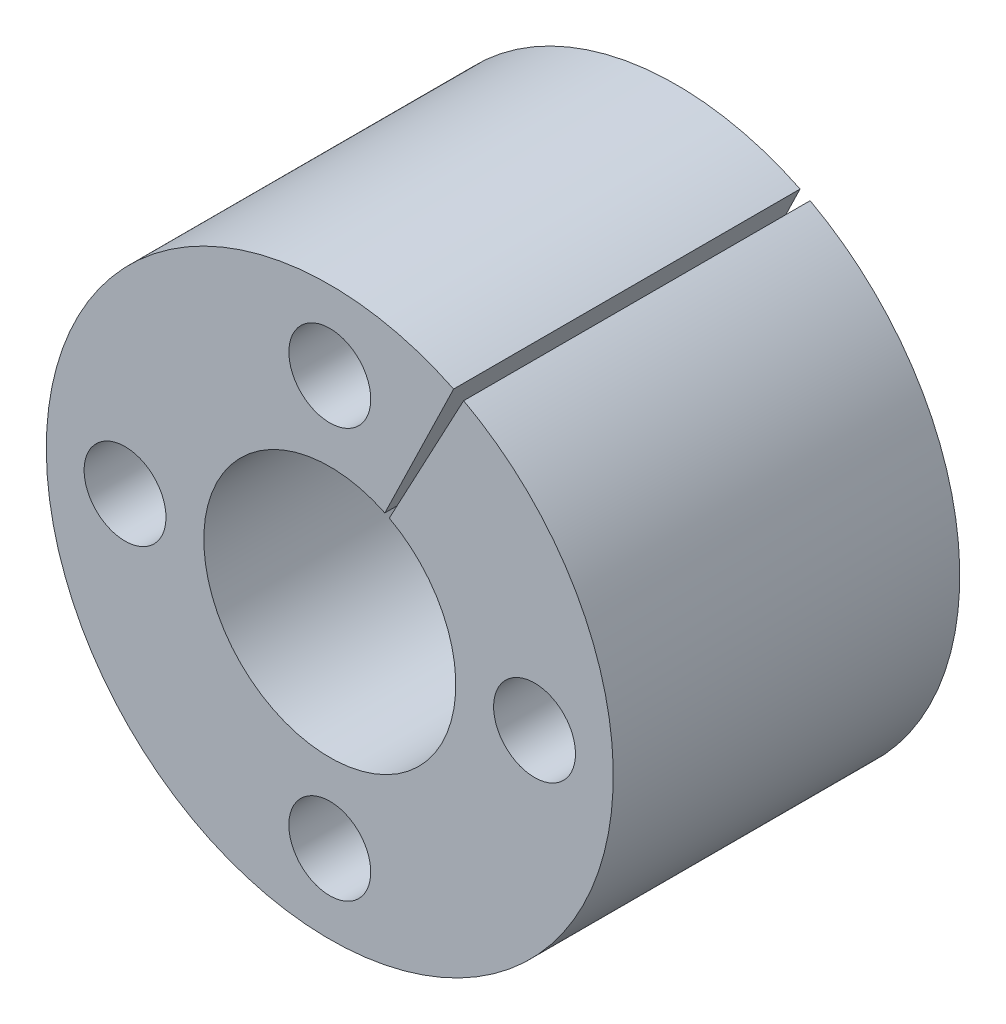
from build123d import *

# Parameters (mm, degrees)
SKETCH_1_R               = 9
SKETCH_1_R_2             = 4
EXTRUDE_1_DEPTH          = 11
CUT_EXTRUDE_1_OUTLINE_R  = 1.3
CUT_EXTRUDE_1_DEPTH      = 11
PATTERN_CIRCULAR_1_COUNT = 4
CUT_EXTRUDE_2_DEPTH      = 17.822603841


# Read off the part's stored shape, not the designer's step: 切除-拉伸1
with BuildPart() as part:
    # 草图1 → 凸台-拉伸1 (new body)
    with BuildSketch(Plane.XY):
        Circle(SKETCH_1_R)
        Circle(SKETCH_1_R_2, mode=Mode.SUBTRACT)
    extrude(amount=EXTRUDE_1_DEPTH)

    # 切除-拉伸1 outline → 切除-拉伸1 (cut)
    with BuildSketch(Plane.XY):
        with Locations((0, 6.5)):
            Circle(CUT_EXTRUDE_1_OUTLINE_R)
    cut_extrude_1 = extrude(amount=CUT_EXTRUDE_1_DEPTH, mode=Mode.SUBTRACT)

    # 阵列(圆周)1: 切除-拉伸1 ×4 about axis
    pattern_circular_1_axis = Axis((0, 0, 0), (0, 0, 1))
    for i in range(1, PATTERN_CIRCULAR_1_COUNT):
        add(cut_extrude_1.rotate(pattern_circular_1_axis, i * 360 / PATTERN_CIRCULAR_1_COUNT), mode=Mode.SUBTRACT)

    # 草图6 → 切除-拉伸2 (cut, through all)
    with BuildSketch(Plane(origin=(0, 0, 0), x_dir=(-1, 0, 0), z_dir=(0, 0, -1))):
        with BuildLine():
            Line((-4.248676402, 7.934024756), (0, 0))
            Line((0, 0), (-3.930859643, 8.096193085))
            ThreePointArc((-3.930859643, 8.096193085), (-4.090571735, 8.016684033), (-4.248676402, 7.934024756))
        make_face()
    extrude(amount=-CUT_EXTRUDE_2_DEPTH, mode=Mode.SUBTRACT)


solid = part.part
